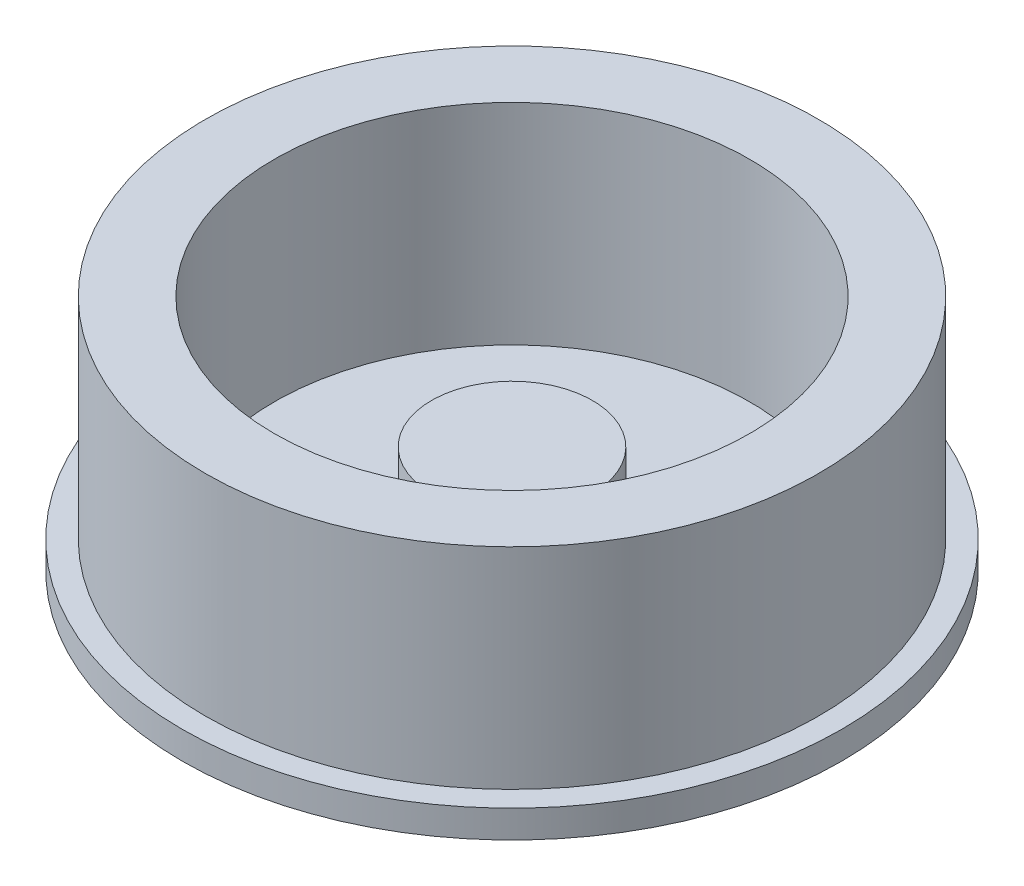
from build123d import *

# Parameters (mm, degrees)
F_01_BOWL_FLANGE_PROFILE_R   = 215
F_01_BOWL_FLANGE_PROFILE_R_2 = 6
F_01_BOWL_BASE_FLANGE_DEPTH  = 18
F_02_BOWL_WALL_PROFILE_R     = 200
F_02_BOWL_WALL_PROFILE_R_2   = 155
F_02_BOWL_WALL_DEPTH         = 155
F_03_CENTER_CONE_BASE_R      = 52.5
F_03_CENTER_GUIDE_BOSS_DEPTH = 70


with BuildPart() as part:
    # 01_Bowl_Flange_Profile → 01_Bowl_Base_Flange (new body)
    with BuildSketch(Plane(origin=(0, 0, 0), x_dir=(1, 0, 0), z_dir=(0, 1, 0))):
        Circle(F_01_BOWL_FLANGE_PROFILE_R)
        with Locations((170.917713515, 70.796434988)):
            Circle(F_01_BOWL_FLANGE_PROFILE_R_2, mode=Mode.SUBTRACT)
        with Locations((70.796434988, 170.917713515)):
            Circle(F_01_BOWL_FLANGE_PROFILE_R_2, mode=Mode.SUBTRACT)
        with Locations((-70.796434988, 170.917713515)):
            Circle(F_01_BOWL_FLANGE_PROFILE_R_2, mode=Mode.SUBTRACT)
        with Locations((-170.917713515, 70.796434988)):
            Circle(F_01_BOWL_FLANGE_PROFILE_R_2, mode=Mode.SUBTRACT)
        with Locations((-170.917713515, -70.796434988)):
            Circle(F_01_BOWL_FLANGE_PROFILE_R_2, mode=Mode.SUBTRACT)
        with Locations((-70.796434988, -170.917713515)):
            Circle(F_01_BOWL_FLANGE_PROFILE_R_2, mode=Mode.SUBTRACT)
        with Locations((70.796434988, -170.917713515)):
            Circle(F_01_BOWL_FLANGE_PROFILE_R_2, mode=Mode.SUBTRACT)
        with Locations((170.917713515, -70.796434988)):
            Circle(F_01_BOWL_FLANGE_PROFILE_R_2, mode=Mode.SUBTRACT)
    extrude(amount=F_01_BOWL_BASE_FLANGE_DEPTH)

    # 02_Bowl_Wall_Profile → 02_Bowl_Wall (add)
    with BuildSketch(Plane(origin=(0, 0, 0), x_dir=(1, 0, 0), z_dir=(0, 1, 0))):
        Circle(F_02_BOWL_WALL_PROFILE_R)
        Circle(F_02_BOWL_WALL_PROFILE_R_2, mode=Mode.SUBTRACT)
    extrude(amount=F_02_BOWL_WALL_DEPTH)

    # 03_Center_Cone_Base → 03_Center_Guide_Boss (add)
    with BuildSketch(Plane(origin=(0, 0, 0), x_dir=(1, 0, 0), z_dir=(0, 1, 0))):
        Circle(F_03_CENTER_CONE_BASE_R)
    extrude(amount=F_03_CENTER_GUIDE_BOSS_DEPTH)


solid = part.part
